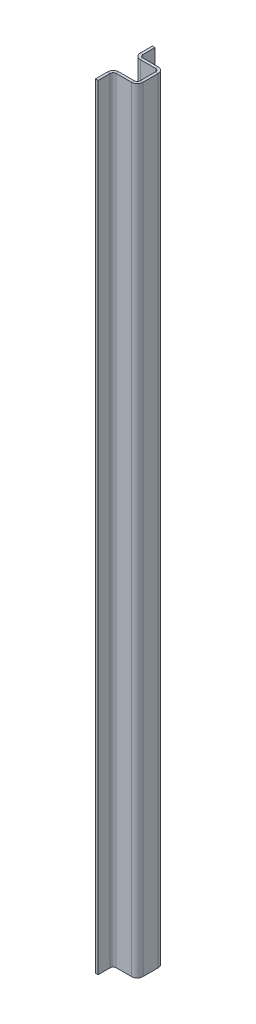
from build123d import *

# Parameters (mm, degrees)
SKETCH2_W                      = 19.05
SKETCH2_H                      = 553.466
BASE_FLANGE1_DEPTH             = 1.89738
EDGE_FLANGE1_STRIP_W           = 11.90752
EDGE_FLANGE1_STRIP_H           = 1.89738
EDGE_FLANGE1_STRIP_CUT_DEPTH   = 553.466
EDGE_FLANGE1_STRIP_2_W         = 11.90752
EDGE_FLANGE1_STRIP_2_H         = 1.89738
EDGE_FLANGE1_STRIP_CUT_2_DEPTH = 553.466
EDGE_FLANGE1_DEPTH             = 553.466
EDGE_FLANGE1_BEND_DEPTH        = 553.466
EDGE_FLANGE2_STRIP_W           = 11.90752
EDGE_FLANGE2_STRIP_H           = 1.89738
EDGE_FLANGE2_STRIP_CUT_DEPTH   = 553.466
EDGE_FLANGE2_STRIP_2_W         = 11.90752
EDGE_FLANGE2_STRIP_2_H         = 1.89738
EDGE_FLANGE2_STRIP_CUT_2_DEPTH = 553.466
EDGE_FLANGE2_DEPTH             = 553.466
EDGE_FLANGE2_BEND_DEPTH        = 553.466


# Sheet-metal steps are written as plain solids
with BuildPart() as part:
    # Sketch2 → Base-Flange1 (new body)
    with BuildSketch(Plane(origin=(0, 0, 0), x_dir=(0, 0, -1), z_dir=(1, 0, 0))):
        Rectangle(SKETCH2_W, SKETCH2_H)
    extrude(amount=-BASE_FLANGE1_DEPTH)

    # Edge-Flange1 strip (across the edge) → Edge-Flange1 strip cut (cut)
    with BuildSketch(Plane(origin=(-1.89738, -276.733, 9.525), x_dir=(0, 0, -1), z_dir=(0, 1, 0))):
        with Locations((-1.89738, -0.94869)):
            Rectangle(EDGE_FLANGE1_STRIP_W, EDGE_FLANGE1_STRIP_H)
    extrude(amount=EDGE_FLANGE1_STRIP_CUT_DEPTH, mode=Mode.SUBTRACT)

    # Edge-Flange1 strip 2 (across the edge) → Edge-Flange1 strip cut 2 (cut)
    with BuildSketch(Plane(origin=(-1.89738, 276.733, -9.525), x_dir=(0, 0, 1), z_dir=(0, -1, 0))):
        with Locations((-1.89738, -0.94869)):
            Rectangle(EDGE_FLANGE1_STRIP_2_W, EDGE_FLANGE1_STRIP_2_H)
    extrude(amount=EDGE_FLANGE1_STRIP_CUT_2_DEPTH, mode=Mode.SUBTRACT)

    # Edge-Flange1 section (across the edge) → Edge-Flange1 (add)
    with BuildSketch(Plane(origin=(-1.89738, -276.733, 9.525), x_dir=(0, 0, -1), z_dir=(0, 1, 0))):
        with BuildLine():
            Line((0, 2.159), (0, 17.15262))
            Line((0, 17.15262), (1.89738, 17.15262))
            Line((1.89738, 17.15262), (1.89738, 2.159))
            ThreePointArc((1.89738, 2.159), (2.529736459, 0.632356459), (4.05638, 0))
            Line((4.05638, 0), (4.05638, -1.89738))
            ThreePointArc((4.05638, -1.89738), (1.188086195, -0.709293805), (0, 2.159))
        make_face()
    extrude(amount=EDGE_FLANGE1_DEPTH)

    # Edge-Flange1 section 2 (across the edge) → Edge-Flange1 bend (add)
    with BuildSketch(Plane(origin=(-1.89738, 276.733, -9.525), x_dir=(0, 0, 1), z_dir=(0, -1, 0))):
        with BuildLine():
            Line((0, 2.159), (0, 17.15262))
            Line((0, 17.15262), (1.89738, 17.15262))
            Line((1.89738, 17.15262), (1.89738, 2.159))
            ThreePointArc((1.89738, 2.159), (2.529736459, 0.632356459), (4.05638, 0))
            Line((4.05638, 0), (4.05638, -1.89738))
            ThreePointArc((4.05638, -1.89738), (1.188086195, -0.709293805), (0, 2.159))
        make_face()
    extrude(amount=EDGE_FLANGE1_BEND_DEPTH)

    # Edge-Flange2 strip (across the edge) → Edge-Flange2 strip cut (cut)
    with BuildSketch(Plane(origin=(-19.05, -276.733, -9.525), x_dir=(1, 0, 0), z_dir=(0, 1, 0))):
        with Locations((-1.89738, -0.94869)):
            Rectangle(EDGE_FLANGE2_STRIP_W, EDGE_FLANGE2_STRIP_H)
    extrude(amount=EDGE_FLANGE2_STRIP_CUT_DEPTH, mode=Mode.SUBTRACT)

    # Edge-Flange2 strip 2 (across the edge) → Edge-Flange2 strip cut 2 (cut)
    with BuildSketch(Plane(origin=(-19.05, 276.733, 9.525), x_dir=(1, 0, 0), z_dir=(0, -1, 0))):
        with Locations((-1.89738, -0.94869)):
            Rectangle(EDGE_FLANGE2_STRIP_2_W, EDGE_FLANGE2_STRIP_2_H)
    extrude(amount=EDGE_FLANGE2_STRIP_CUT_2_DEPTH, mode=Mode.SUBTRACT)

    # Edge-Flange2 section (across the edge) → Edge-Flange2 (add)
    with BuildSketch(Plane(origin=(-19.05, -276.733, -9.525), x_dir=(1, 0, 0), z_dir=(0, 1, 0))):
        with BuildLine():
            Line((0, 2.159), (0, 10.80262))
            Line((0, 10.80262), (1.89738, 10.80262))
            Line((1.89738, 10.80262), (1.89738, 2.159))
            ThreePointArc((1.89738, 2.159), (2.529736459, 0.632356459), (4.05638, 0))
            Line((4.05638, 0), (4.05638, -1.89738))
            ThreePointArc((4.05638, -1.89738), (1.188086195, -0.709293805), (0, 2.159))
        make_face()
    extrude(amount=EDGE_FLANGE2_DEPTH)

    # Edge-Flange2 section 2 (across the edge) → Edge-Flange2 bend (add)
    with BuildSketch(Plane(origin=(-19.05, 276.733, 9.525), x_dir=(1, 0, 0), z_dir=(0, -1, 0))):
        with BuildLine():
            Line((0, 2.159), (0, 10.80262))
            Line((0, 10.80262), (1.89738, 10.80262))
            Line((1.89738, 10.80262), (1.89738, 2.159))
            ThreePointArc((1.89738, 2.159), (2.529736459, 0.632356459), (4.05638, 0))
            Line((4.05638, 0), (4.05638, -1.89738))
            ThreePointArc((4.05638, -1.89738), (1.188086195, -0.709293805), (0, 2.159))
        make_face()
    extrude(amount=EDGE_FLANGE2_BEND_DEPTH)


solid = part.part
